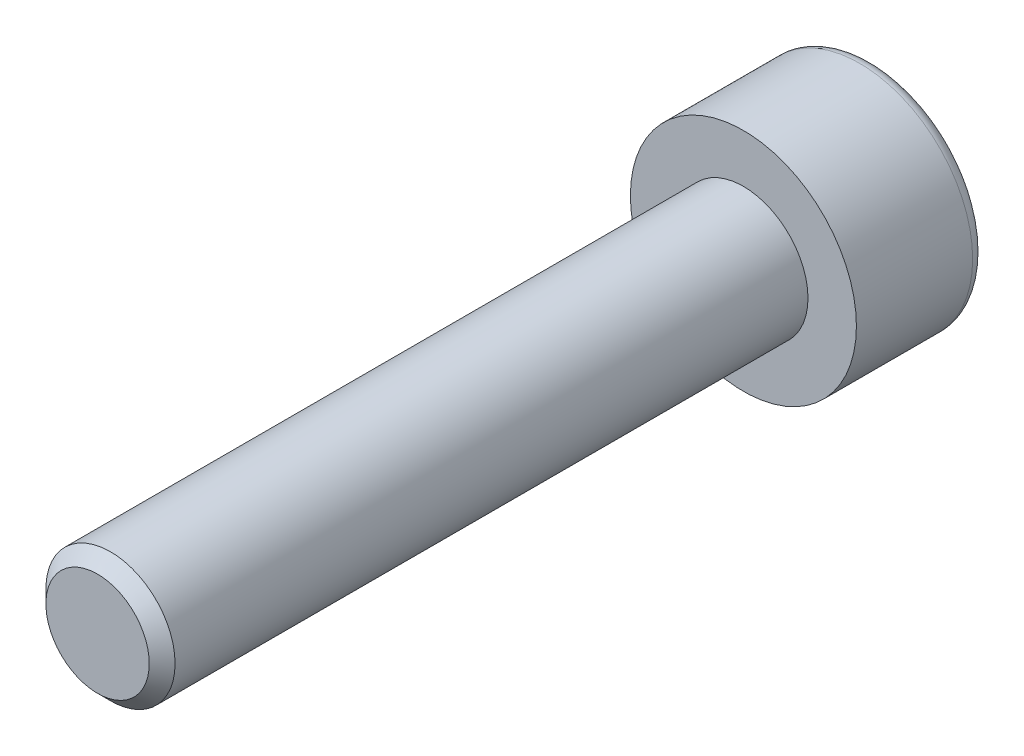
from build123d import *

# Parameters (mm, degrees)
ENLEV_MAT_EXTRU1_DEPTH = 2
ESQUISSE3_W            = 2
ESQUISSE3_H            = 20
CHANFREIN1_SIZE        = 0.4


with BuildPart() as part:
    # Esquisse1 → Base-Révolution (revolve)
    with BuildSketch(Plane(origin=(0, 0, 0), x_dir=(1, 0, 0), z_dir=(0, 1, 0)), mode=Mode.PRIVATE) as base_r_volution_sk:
        with BuildLine():
            Line((0, 0), (3.5, 0))
            Line((3.5, 0), (3.5, 3.6))
            ThreePointArc((3.5, 3.6), (3.382842712, 3.882842712), (3.1, 4))
            Line((3.1, 4), (0, 4))
            Line((0, 4), (0, 0))
        make_face()
    revolve(base_r_volution_sk.sketch.rotate(Axis((0, 0, 0), (0, 0, -1)), 180), axis=Axis((0, 0, 0), (0, 0, -1)))

    # Esquisse2 → enlev-mat-Extru1 (cut)
    with BuildSketch(Plane.XY.offset(-4)):
        Polygon((1.5, -0.866025404), (1.5, 0.866025404), (0, 1.732050808), (-1.5, 0.866025404), (-1.5, -0.866025404), (0, -1.732050808), align=None)
    extrude(amount=ENLEV_MAT_EXTRU1_DEPTH, mode=Mode.SUBTRACT)

    # Esquisse3 → Boss.-Révol.1 (revolve)
    with BuildSketch(Plane(origin=(0, 0, 0), x_dir=(1, 0, 0), z_dir=(0, 1, 0))):
        with Locations((1, -10)):
            Rectangle(ESQUISSE3_W, ESQUISSE3_H)
    revolve(axis=Axis((0, 0, 0), (0, 0, 1)))

    # Chanfrein1
    chanfrein1_edges = [part.edges().sort_by_distance(p)[0] for p in [
        (-2, 0, 20),
    ]]
    chamfer(chanfrein1_edges, length=CHANFREIN1_SIZE)


solid = part.part
